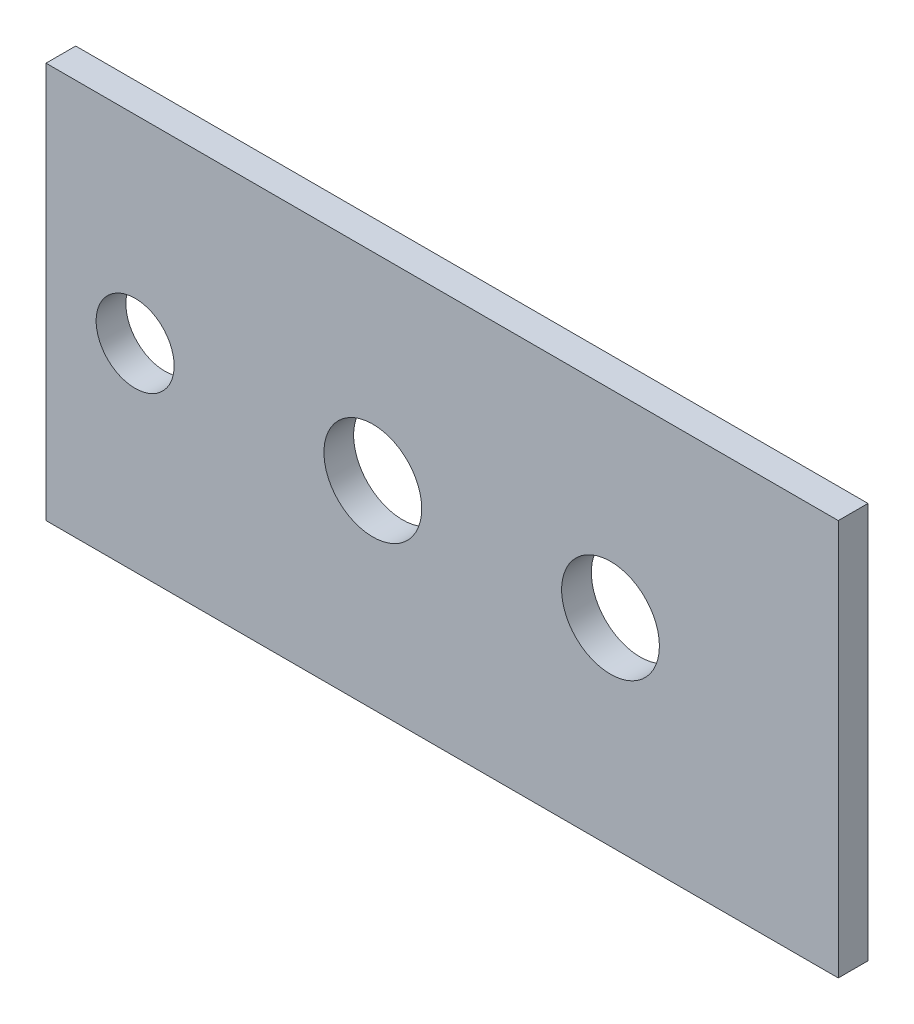
from build123d import *

# Parameters (mm, degrees)
SKETCH1_W           = 80
SKETCH1_H           = 40
BOSS_EXTRUDE1_DEPTH = 3
SKETCH2_R           = 3.9365
SKETCH2_R_2         = 4.9365
CUT_EXTRUDE1_DEPTH  = 90.493016487


with BuildPart() as part:
    # Sketch1 → Boss-Extrude1 (new body)
    with BuildSketch(Plane.XY):
        with Locations((40, 20)):
            Rectangle(SKETCH1_W, SKETCH1_H)
    extrude(amount=BOSS_EXTRUDE1_DEPTH)

    # Sketch2 → Cut-Extrude1 (cut, through all)
    with BuildSketch(Plane.XY.offset(3)):
        with Locations((9, 20)):
            Circle(SKETCH2_R)
        with Locations((57, 20)):
            Circle(SKETCH2_R_2)
        with Locations((33, 20)):
            Circle(SKETCH2_R_2)
    extrude(amount=-CUT_EXTRUDE1_DEPTH, mode=Mode.SUBTRACT)


solid = part.part
